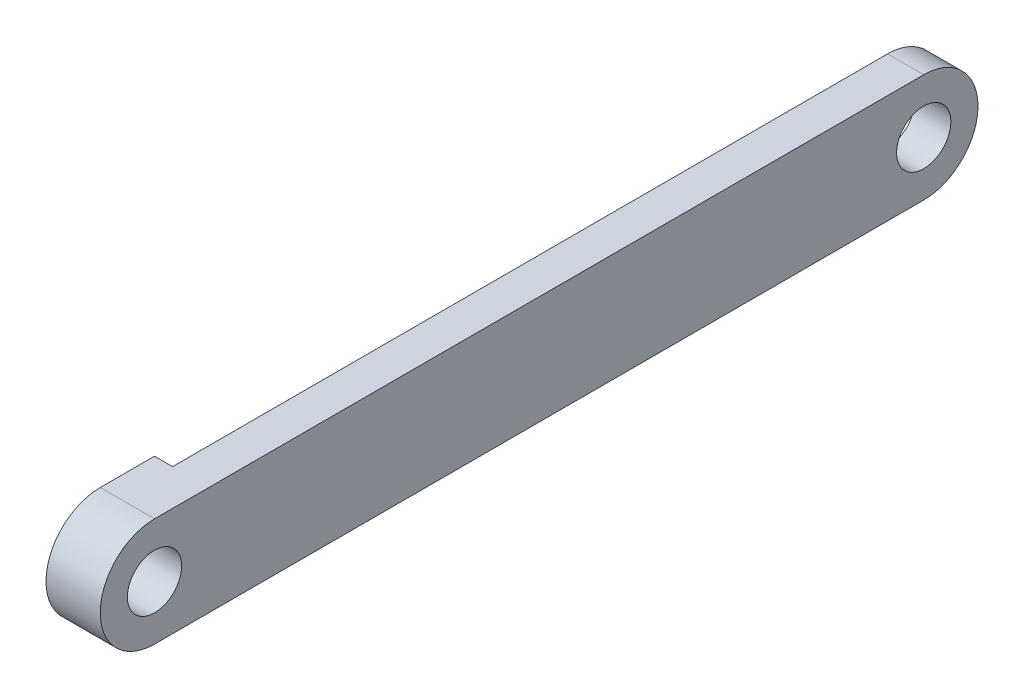
from build123d import *

# Parameters (mm, degrees)
SKETCH1_R           = 1.5
BOSS_EXTRUDE1_DEPTH = 3
SKETCH3_W           = 42.53
SKETCH3_H           = 6
CUT_EXTRUDE2_DEPTH  = 1


with BuildPart() as part:
    # Sketch1 → Boss-Extrude1 (new body)
    with BuildSketch(Plane(origin=(0, 0, 0), x_dir=(0, 0, -1), z_dir=(1, 0, 0))):
        with BuildLine():
            Line((0, 3), (42.53, 3))
            ThreePointArc((42.53, 3), (45.53, 0), (42.53, -3))
            Line((42.53, -3), (0, -3))
            ThreePointArc((0, -3), (-3, 0), (0, 3))
        make_face()
        Circle(SKETCH1_R, mode=Mode.SUBTRACT)
        with Locations((42.53, 0)):
            Circle(SKETCH1_R, mode=Mode.SUBTRACT)
    extrude(amount=BOSS_EXTRUDE1_DEPTH)

    # Sketch3 → Cut-Extrude2 (cut)
    with BuildSketch(Plane.ZY):
        with Locations((-24.265, 0)):
            Rectangle(SKETCH3_W, SKETCH3_H)
    extrude(amount=-CUT_EXTRUDE2_DEPTH, mode=Mode.SUBTRACT)


solid = part.part
